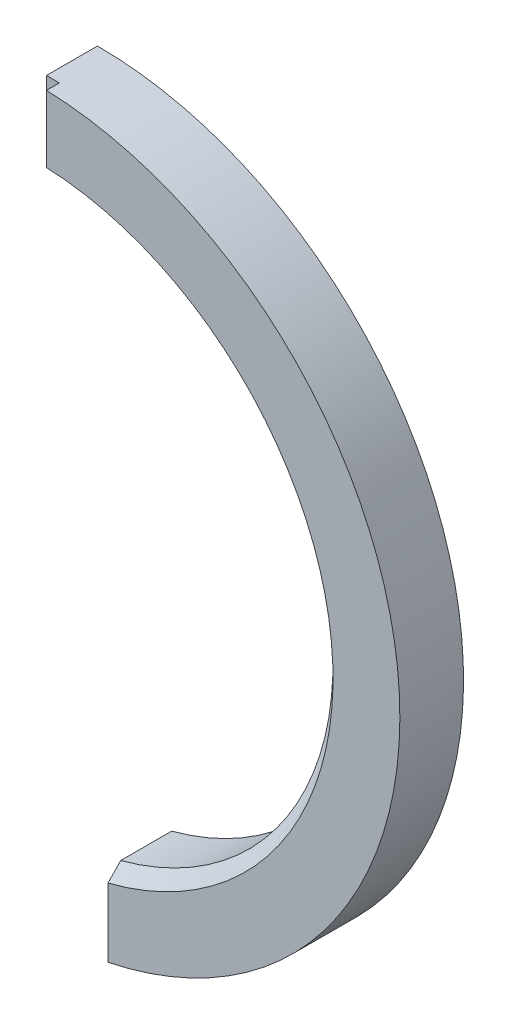
from build123d import *

# Parameters (mm, degrees)
SKETCH1_R                = 57.5
SKETCH1_R_2              = 45.00000000000001
BOSS_EXTRUDE1_DEPTH      = 10
CUT_EXTRUDE2_DEPTH       = 10
CHAMFER1_SIZE            = 2
SKETCH3_W                = 124.11314463773925
SKETCH3_H                = 66.87650026596636
CUT_EXTRUDE3_DEPTH       = 10
CUT_EXTRUDE4_START       = -2
SKETCH5_R                = 4.000000000000001
CUT_EXTRUDE4_DEPTH       = 3
SKETCH7_W                = 12.5
SKETCH7_H                = 2
CUT_EXTRUDE8_DEPTH       = 2
CHAMFER1_OF_MIRROR2_SIZE = 2


with BuildPart() as part:
    # Sketch1 → Boss-Extrude1 (new body)
    with BuildSketch(Plane(origin=(0, 0, 0), x_dir=(0, 1, 0), z_dir=(0, 0, 1))):
        Circle(SKETCH1_R)
        Circle(SKETCH1_R_2, mode=Mode.SUBTRACT)
    boss_extrude1 = extrude(amount=BOSS_EXTRUDE1_DEPTH)

    # Sketch2 → Cut-Extrude2 (cut)
    with BuildSketch(Plane(origin=(0, 0, 0), x_dir=(1, 0, 0), z_dir=(0, 0, -1))):
        with BuildLine():
            Line((11.650511373343255, 56.65985738578664), (11.650511373343253, 43.46568283990946))
            add(Edge.make_bspline(
                [(11.650511373343253, 43.46568283990946), (-0.6792465581096698, 46.406413024211304), (-11.650511373343253, 43.46568283990946)],
                knots=[0, 0, 0, 0.5755474578106329, 0.5755474578106329, 0.5755474578106329], degree=2))
            Line((-11.650511373343253, 43.46568283990946), (-11.650511373343255, 56.65985738578664))
            ThreePointArc((-11.650511373343255, 56.65985738578664), (3.54e-15, 57.84525783707841), (11.650511373343255, 56.65985738578664))
        make_face()
    cut_extrude2 = extrude(amount=-CUT_EXTRUDE2_DEPTH, mode=Mode.SUBTRACT)

    # Chamfer1
    chamfer1_edges = [part.edges().sort_by_distance(p)[0] for p in [
        (-5.33e-15, 45.000000000000014, 10),
    ]]
    chamfer(chamfer1_edges, length=CHAMFER1_SIZE)

    # Sketch3 → Cut-Extrude3 (cut)
    with BuildSketch(Plane(origin=(0, 0, 0), x_dir=(0, 1, 0), z_dir=(0, 0, 1))):
        with Locations((4.6416309017311725, -33.43825013298318)):
            Rectangle(SKETCH3_W, SKETCH3_H)
    cut_extrude3 = extrude(amount=CUT_EXTRUDE3_DEPTH, mode=Mode.SUBTRACT)

    # Sketch5 → Cut-Extrude4 (cut)
    with BuildSketch(Plane(origin=(0, 0, 0), x_dir=(1, 0, 0), z_dir=(0, 0, -1)).offset(CUT_EXTRUDE4_START)):
        with Locations((-6, -51.25000000000001)):
            Circle(SKETCH5_R)
    cut_extrude4 = extrude(amount=-CUT_EXTRUDE4_DEPTH, mode=Mode.SUBTRACT)

    # Sketch7 → Cut-Extrude8 (cut)
    with BuildSketch(Plane.YZ):
        with Locations((51.25000000000001, 9)):
            Rectangle(SKETCH7_W, SKETCH7_H)
    cut_extrude8 = extrude(amount=-CUT_EXTRUDE8_DEPTH, mode=Mode.SUBTRACT)

    # Mirror2: Boss-Extrude1, Cut-Extrude2, Cut-Extrude3, Cut-Extrude4, Cut-Extrude8 across plane
    add(boss_extrude1.mirror(Plane(origin=(0, 0, 0), x_dir=(0, 0, 1), z_dir=(1, 0, 0))))
    add(cut_extrude2.mirror(Plane(origin=(0, 0, 0), x_dir=(0, 0, 1), z_dir=(1, 0, 0))), mode=Mode.SUBTRACT)
    add(cut_extrude3.mirror(Plane(origin=(0, 0, 0), x_dir=(0, 0, 1), z_dir=(1, 0, 0))), mode=Mode.SUBTRACT)
    add(cut_extrude4.mirror(Plane(origin=(0, 0, 0), x_dir=(0, 0, 1), z_dir=(1, 0, 0))), mode=Mode.SUBTRACT)
    add(cut_extrude8.mirror(Plane(origin=(0, 0, 0), x_dir=(0, 0, 1), z_dir=(1, 0, 0))), mode=Mode.SUBTRACT)

    # Chamfer1 of Mirror2
    chamfer1_of_mirror2_edges = [part.edges().sort_by_distance(p)[0] for p in [
        (5.33e-15, 45.000000000000014, 10),
    ]]
    chamfer(chamfer1_of_mirror2_edges, length=CHAMFER1_OF_MIRROR2_SIZE)


solid = part.part
